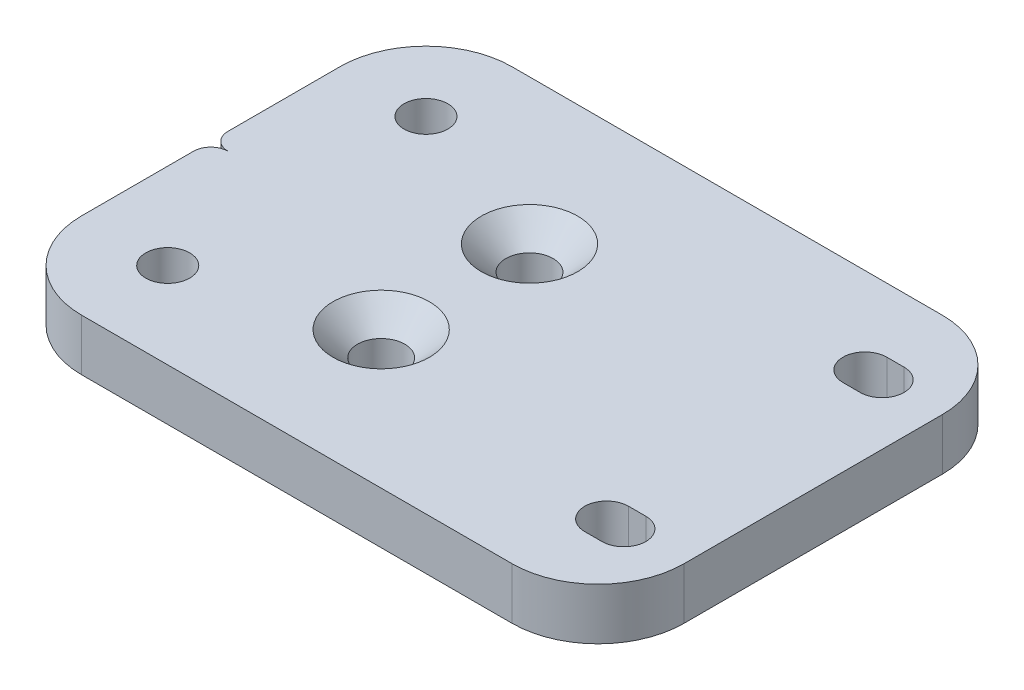
from build123d import *

# Parameters (mm, degrees)
EXTRUDE_1_DEPTH             = 6
SKETCH_2_R                  = 2.55
CUT_EXTRUDE_1_DEPTH         = 44.428101501
CUT_EXTRUDE_2_DEPTH         = 44.428101501
HOLE_WIZARD_M52_D           = 5.5
HOLE_WIZARD_M52_CSINK_D     = 11.2
HOLE_WIZARD_M52_CSINK_ANGLE = 90


with BuildPart() as part:
    # Эскиз1 → Бобышка-Вытянуть1 (new body)
    with BuildSketch(Plane(origin=(0, 0, 0), x_dir=(1, 0, 0), z_dir=(0, 1, 0))):
        with BuildLine():
            Line((-25, -25), (25, -25))
            ThreePointArc((25, -25), (32.071067812, -22.071067812), (35, -15))
            Line((35, -15), (35, 15))
            ThreePointArc((35, 15), (32.071067812, 22.071067812), (25, 25))
            Line((25, 25), (-25, 25))
            ThreePointArc((-25, 25), (-32.071067812, 22.071067812), (-35, 15))
            Line((-35, 15), (-35, -15))
            ThreePointArc((-35, -15), (-32.071067812, -22.071067812), (-25, -25))
        make_face()
    extrude(amount=EXTRUDE_1_DEPTH)

    # Эскиз2 → Вырез-Вытянуть1 (cut, through all)
    with BuildSketch(Plane.XZ):
        with Locations((-25, -15)):
            Circle(SKETCH_2_R)
        with Locations((-25, 15)):
            Circle(SKETCH_2_R)
        with BuildLine():
            Line((28, -17.55), (26, -17.55))
            ThreePointArc((26, -17.55), (23.45, -15), (26, -12.45))
            Line((26, -12.45), (28, -12.45))
            ThreePointArc((28, -12.45), (30.55, -15), (28, -17.55))
        make_face()
        with BuildLine():
            Line((28, 17.55), (26, 17.55))
            ThreePointArc((26, 17.55), (23.45, 15), (26, 12.45))
            Line((26, 12.45), (28, 12.45))
            ThreePointArc((28, 12.45), (30.55, 15), (28, 17.55))
        make_face()
    extrude(amount=-CUT_EXTRUDE_1_DEPTH, mode=Mode.SUBTRACT)

    # Эскиз3 → Вырез-Вытянуть2 (cut, through all)
    with BuildSketch(Plane.XZ):
        with BuildLine():
            Line((-35, -2), (-35, 2))
            ThreePointArc((-35, 2), (-34.414213562, 0.585786438), (-33, 0))
            ThreePointArc((-33, 0), (-34.414213562, -0.585786438), (-35, -2))
        make_face()
    extrude(amount=-CUT_EXTRUDE_2_DEPTH, mode=Mode.SUBTRACT)

    # Зенковка для  винта с потайной головкой с внутренним шестигранником M52 (through all)
    with Locations(Plane(origin=(0, 6, 0), x_dir=(1, 0, 0), z_dir=(0, 1, 0))):
        with Locations((-6.159381211, -9.040339254), (-6.159381211, 8.192585184)):
            CounterSinkHole(HOLE_WIZARD_M52_D / 2, HOLE_WIZARD_M52_CSINK_D / 2, counter_sink_angle=HOLE_WIZARD_M52_CSINK_ANGLE)


solid = part.part
